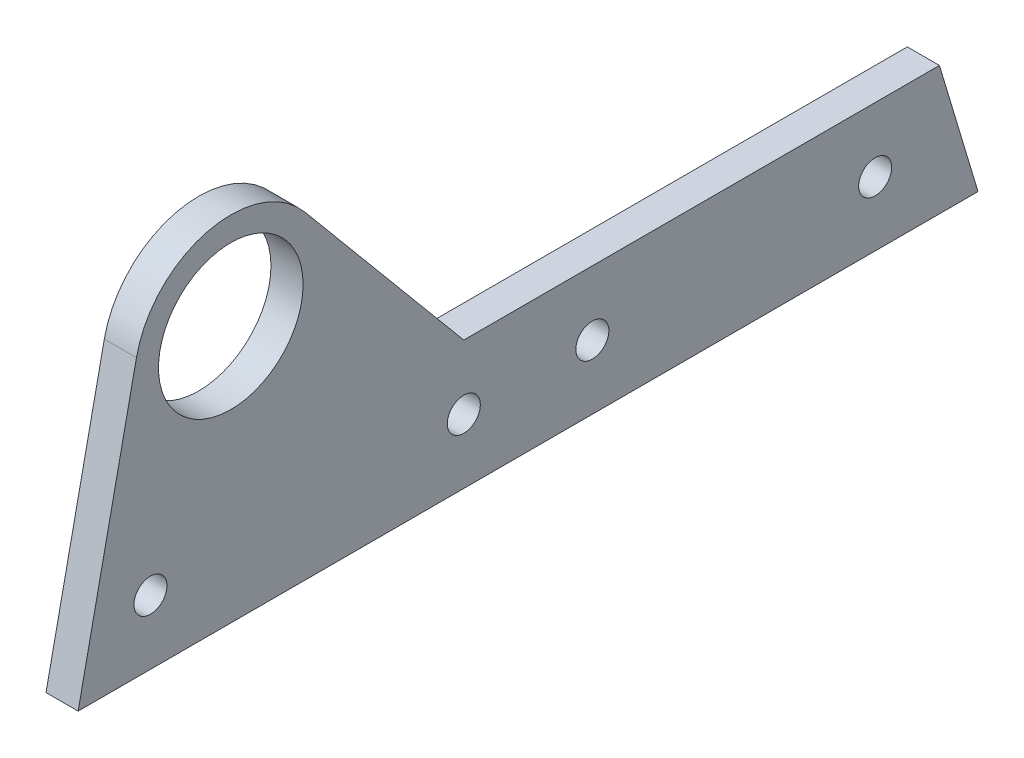
from build123d import *

# Parameters (mm, degrees)
SKETCH1_R           = 14.2875
SKETCH1_R_2         = 3.2639
BOSS_EXTRUDE1_DEPTH = 6.35


with BuildPart() as part:
    # Sketch1 → Boss-Extrude1 (new body)
    with BuildSketch(Plane(origin=(0, 0, 0), x_dir=(0, 0, -1), z_dir=(1, 0, 0))):
        with BuildLine():
            Line((-12.7, -12.7), (-88.9, -12.7))
            Line((-88.9, -12.7), (-77.378861091, 42.024558148))
            ThreePointArc((-77.378861091, 42.024558148), (-63.34330116, 56.584834207), (-44.116908592, 50.312321928))
            Line((-44.116908592, 50.312321928), (-12.7, 12.7))
            Line((-12.7, 12.7), (25.4, 12.7))
            Line((25.4, 12.7), (81.28, 12.7))
            Line((81.28, 12.7), (88.9, -12.7))
            Line((88.9, -12.7), (25.4, -12.7))
            Line((25.4, -12.7), (-12.7, -12.7))
        make_face()
        with Locations((-58.7375, 38.1)):
            Circle(SKETCH1_R, mode=Mode.SUBTRACT)
        with Locations((-12.7, 0)):
            Circle(SKETCH1_R_2, mode=Mode.SUBTRACT)
        with Locations((12.7, 0)):
            Circle(SKETCH1_R_2, mode=Mode.SUBTRACT)
        with Locations((-74.6125, 0)):
            Circle(SKETCH1_R_2, mode=Mode.SUBTRACT)
        with Locations((68.58, 0)):
            Circle(SKETCH1_R_2, mode=Mode.SUBTRACT)
    extrude(amount=BOSS_EXTRUDE1_DEPTH)


solid = part.part
